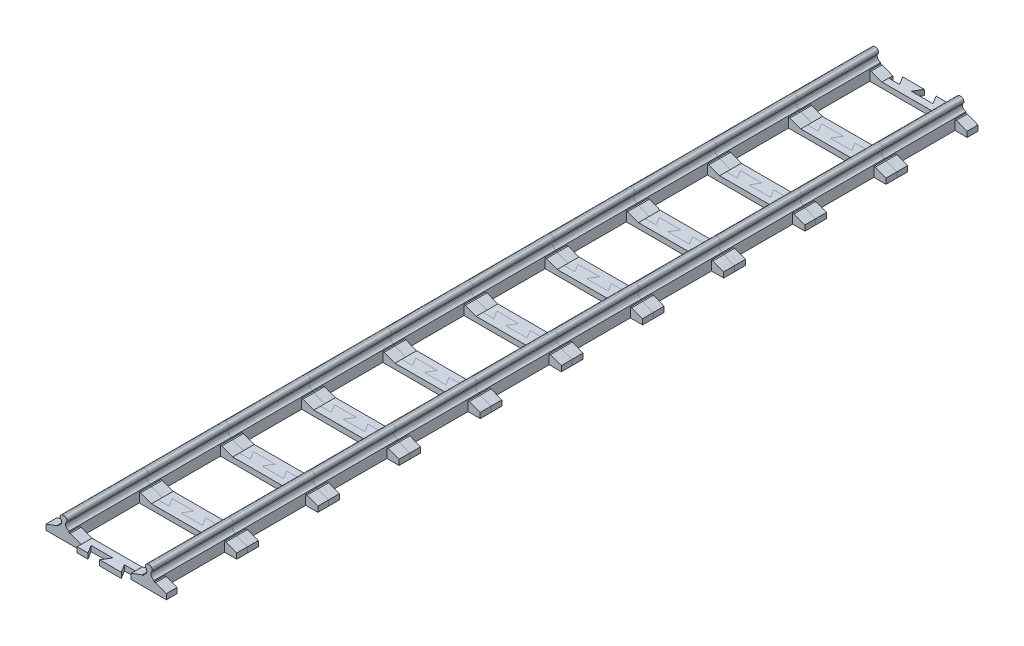
from build123d import *

# Parameters (mm, degrees)
SKETCH_1_W               = 4
SKETCH_1_H               = 11
SKETCH_1_H_2             = 8
EXTRUDE_1_DEPTH          = 4
SKETCH_1_7_W             = 44.5
SKETCH_1_7_H             = 8
EXTRUDE_2_DEPTH          = 3.5
SKETCH_2_W               = 18.5
SKETCH_2_H               = 1.5
CUT_EXTRUDE_1_DEPTH      = 30.53070436
SKETCH_2_3_W             = 2.5
SKETCH_2_3_H             = 1.5
EXTRUDE_4_DEPTH          = 19
FILLET_1_R               = 1
FILLET_2_R               = 1.5
FILLET_3_R               = 1
CUT_EXTRUDE_2_DEPTH      = 37.65122781
CUT_EXTRUDE_2_DEPTH_BACK = 37.65122781
PATTERN_LINEAR_1_COUNT   = 10
PATTERN_LINEAR_1_PITCH   = 30


with BuildPart() as part:
    # 草图1 → 凸台-拉伸1 (new body)
    with BuildSketch(Plane(origin=(0, 0, 0), x_dir=(1, 0, 0), z_dir=(0, 1, 0))):
        with Locations((-15.75, -4)):
            Rectangle(SKETCH_1_W, SKETCH_1_H)
        with Locations((15.75, -4)):
            Rectangle(SKETCH_1_W, SKETCH_1_H)
        with Locations((15.75, 5.5)):
            Rectangle(SKETCH_1_W, SKETCH_1_H_2)
        with Locations((-15.75, 5.5)):
            Rectangle(SKETCH_1_W, SKETCH_1_H_2)
    extrude(amount=EXTRUDE_1_DEPTH)

    # 草图1<7> → 凸台-拉伸2 (add)
    with BuildSketch(Plane(origin=(0, 0, 0), x_dir=(1, 0, 0), z_dir=(0, 1, 0))):
        with Locations((0, 5.5)):
            Rectangle(SKETCH_1_7_W, SKETCH_1_7_H)
    extrude(amount=EXTRUDE_2_DEPTH)

    # 草图2 → 切除-拉伸1 (cut, through all)
    with BuildSketch(Plane(origin=(0, 0, -9.5), x_dir=(-1, 0, 0), z_dir=(0, 0, -1))):
        with Locations((0, 2.75)):
            Rectangle(SKETCH_2_W, SKETCH_2_H)
        Polygon((13.25, 3.5), (9.25, 3.5), (9.25, 2), align=None)
        Polygon((-9.25, 3.5), (-13.25, 3.5), (-9.25, 2), align=None)
        Polygon((-22.25, 3.5), (-22.25, 2), (-18.25, 3.5), align=None)
        Polygon((22.25, 3.5), (18.25, 3.5), (22.25, 2), align=None)
    extrude(amount=-CUT_EXTRUDE_1_DEPTH, mode=Mode.SUBTRACT)

    # 草图2<3> → 凸台-拉伸4 (add, through all)
    with BuildSketch(Plane(origin=(0, 0, -9.5), x_dir=(-1, 0, 0), z_dir=(0, 0, -1))):
        with Locations((-15.75, 7.25)):
            Rectangle(SKETCH_2_3_W, SKETCH_2_3_H)
        Polygon((-15, 6.5), (-16.5, 6.5), (-16.5, 4), (-15.75, 4), (-15, 4), align=None)
        with Locations((15.75, 7.25)):
            Rectangle(SKETCH_2_3_W, SKETCH_2_3_H)
        Polygon((16.5, 6.5), (15, 6.5), (15, 4), (15.75, 4), (16.5, 4), align=None)
    extrude(amount=-EXTRUDE_4_DEPTH)

    # 圆角1
    # the kernel refuses this fillet: 1 mm, written as the material it adds along each edge
    with BuildSketch(Plane(origin=(-16.5, 6.5, -9.5), x_dir=(0, -1, 0), z_dir=(0, 0, 1))) as fillet_1_piece_1:
        with BuildLine():
            CenterArc((0.866025404, -1), FILLET_1_R, 90, 60)
            Line((0, -0.5), (-0.017320508, -0.49))
            ThreePointArc((-0.017320508, -0.49), (-0.02, -0.25), (-0.02, 0))
            Line((-0.02, 0), (0, 0.02))
            Line((0, 0.02), (0.866025404, 0.02))
            Line((0.866025404, 0.02), (0.866025404, 0))
        make_face()
    extrude(amount=19)
    with BuildSketch(Plane(origin=(-15, 6.5, -9.5), x_dir=(0, -1, 0), z_dir=(0, 0, 1)), Plane(origin=(16.5, 6.5, -9.5), x_dir=(0, -1, 0), z_dir=(0, 0, 1))) as fillet_1_piece_2:
        with BuildLine():
            CenterArc((0.866025404, 1), FILLET_1_R, 210, 60)
            Line((0, 0.5), (-0.017320508, 0.49))
            ThreePointArc((-0.017320508, 0.49), (-0.02, 0.25), (-0.02, 0))
            Line((-0.02, 0), (0, -0.02))
            Line((0, -0.02), (0.866025404, -0.02))
            Line((0.866025404, -0.02), (0.866025404, 0))
        make_face()
    extrude(amount=19)
    with BuildSketch(Plane(origin=(15, 6.5, -9.5), x_dir=(-1, 0, 0), z_dir=(0, 0, 1))) as fillet_1_piece_3:
        with BuildLine():
            CenterArc((1, 0.866025404), FILLET_1_R, 180, 60)
            Line((0, 0.866025404), (-0.02, 0.866025404))
            Line((-0.02, 0.866025404), (-0.02, 0))
            Line((-0.02, 0), (0, -0.02))
            ThreePointArc((0, -0.02), (0.25, -0.02), (0.49, -0.017320508))
            Line((0.49, -0.017320508), (0.5, 0))
        make_face()
    extrude(amount=19)

    # 圆角2
    # the kernel refuses this fillet: 1.5 mm, written as the material it adds along each edge
    with BuildSketch(Plane(origin=(16.5, 4, -9.5), x_dir=(1, 0, 0), z_dir=(0, 0, 1)), Plane(origin=(-15, 4, -9.5), x_dir=(1, 0, 0), z_dir=(0, 0, 1))) as fillet_2_piece_1:
        with BuildLine():
            CenterArc((1.5, 1.479019946), FILLET_2_R, 180, 80.405931773)
            Line((0, 1.479019946), (-0.03, 1.479019946))
            Line((-0.03, 1.479019946), (-0.03, 0))
            Line((-0.03, 0), (0, -0.03))
            ThreePointArc((0, -0.03), (0.625, -0.03), (1.245, -0.029580399))
            Line((1.245, -0.029580399), (1.25, 0))
        make_face()
    extrude(amount=19)
    with BuildSketch(Plane(origin=(15, 4, -9.5), x_dir=(0, 1, 0), z_dir=(0, 0, 1)), Plane(origin=(-16.5, 4, -9.5), x_dir=(0, 1, 0), z_dir=(0, 0, 1))) as fillet_2_piece_2:
        with BuildLine():
            CenterArc((1.479019946, 1.5), FILLET_2_R, 189.594068227, 80.405931773)
            Line((0, 1.25), (-0.029580399, 1.245))
            ThreePointArc((-0.029580399, 1.245), (-0.03, 0.625), (-0.03, 0))
            Line((-0.03, 0), (0, -0.03))
            Line((0, -0.03), (1.479019946, -0.03))
            Line((1.479019946, -0.03), (1.479019946, 0))
        make_face()
    extrude(amount=19)

    # 圆角3
    fillet_3_edges = [part.edges().sort_by_distance(p)[0] for p in [
        (14.5, 8, 0),
        (17, 8, 0),
        (-17, 8, 0),
        (-14.5, 8, 0),
    ]]
    fillet(fillet_3_edges, radius=FILLET_3_R)

    # 镜向2: part across plane


with BuildPart() as part_1:
    add(part.part)
    add(part.part.mirror(Plane(origin=(0, 4, 9.5), x_dir=(1, 0, 0), z_dir=(0, 0, -1))))

    # 草图9 → 切除-拉伸2 (cut, two sides: drawn at the far end of the back side and taken through both)
    with BuildSketch(Plane(origin=(0, 2, 0), x_dir=(1, 0, 0), z_dir=(0, 1, 0)).offset(-CUT_EXTRUDE_2_DEPTH_BACK)):
        Polygon((-22.25, 5.5), (-9.25, 5.5), (-9.25, 4), (-5.25, 4), (-7.083333333, 7), (0.916666667, 7), (-0.916666667, 4), (7.083333333, 4), (5.25, 7), (9.25, 7), (9.25, 5.5), (22.25, 5.5), (22.25, 9.5), (-22.25, 9.5), align=None)
        Polygon((-22.25, -24.5), (-9.25, -24.5), (-9.25, -26), (-5.25, -26), (-7.083333333, -23), (0.916666667, -23), (-0.916666667, -26), (7.083333333, -26), (5.25, -23), (9.25, -23), (9.25, -24.5), (22.25, -24.5), (22.25, -28.5), (-22.25, -28.5), align=None)
    extrude(amount=CUT_EXTRUDE_2_DEPTH + CUT_EXTRUDE_2_DEPTH_BACK, mode=Mode.SUBTRACT)


with BuildPart() as pattern_linear_1_1:
    # 阵列(线性)1: pattern copy
    add(part_1.part.moved(Location(Vector(0, 0, -1) * (1 * PATTERN_LINEAR_1_PITCH))))


with BuildPart() as pattern_linear_1_2:
    # 阵列(线性)1: pattern copy
    add(part_1.part.moved(Location(Vector(0, 0, -1) * (2 * PATTERN_LINEAR_1_PITCH))))


with BuildPart() as pattern_linear_1_3:
    # 阵列(线性)1: pattern copy
    add(part_1.part.moved(Location(Vector(0, 0, -1) * (3 * PATTERN_LINEAR_1_PITCH))))


with BuildPart() as pattern_linear_1_4:
    # 阵列(线性)1: pattern copy
    add(part_1.part.moved(Location(Vector(0, 0, -1) * (4 * PATTERN_LINEAR_1_PITCH))))


with BuildPart() as pattern_linear_1_5:
    # 阵列(线性)1: pattern copy
    add(part_1.part.moved(Location(Vector(0, 0, -1) * (5 * PATTERN_LINEAR_1_PITCH))))


with BuildPart() as pattern_linear_1_6:
    # 阵列(线性)1: pattern copy
    add(part_1.part.moved(Location(Vector(0, 0, -1) * (6 * PATTERN_LINEAR_1_PITCH))))


with BuildPart() as pattern_linear_1_7:
    # 阵列(线性)1: pattern copy
    add(part_1.part.moved(Location(Vector(0, 0, -1) * (7 * PATTERN_LINEAR_1_PITCH))))


with BuildPart() as pattern_linear_1_8:
    # 阵列(线性)1: pattern copy
    add(part_1.part.moved(Location(Vector(0, 0, -1) * (8 * PATTERN_LINEAR_1_PITCH))))


with BuildPart() as pattern_linear_1_9:
    # 阵列(线性)1: pattern copy
    add(part_1.part.moved(Location(Vector(0, 0, -1) * (9 * PATTERN_LINEAR_1_PITCH))))


solid = Compound([part_1.part, pattern_linear_1_1.part, pattern_linear_1_2.part, pattern_linear_1_3.part, pattern_linear_1_4.part, pattern_linear_1_5.part, pattern_linear_1_6.part, pattern_linear_1_7.part, pattern_linear_1_8.part, pattern_linear_1_9.part])
